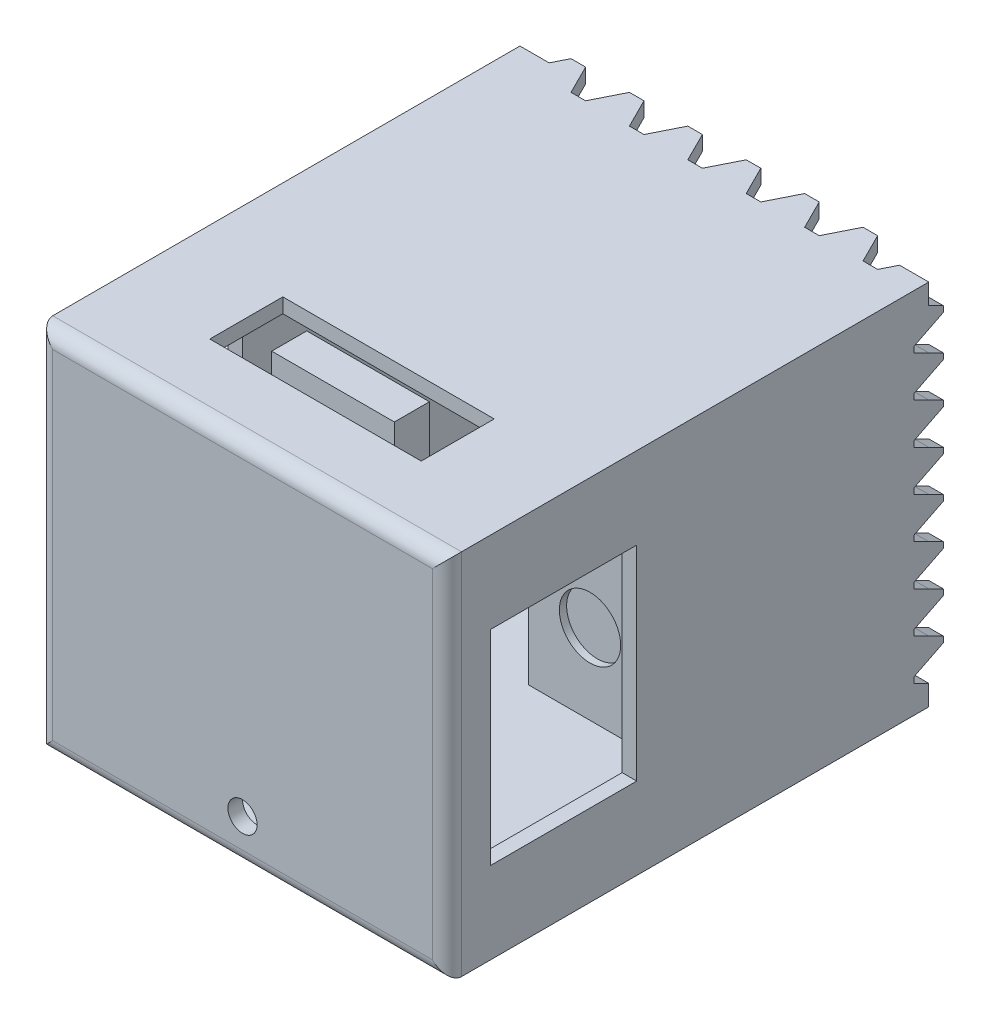
from build123d import *

# Parameters (mm, degrees)
SKETCH1_W                = 140
SKETCH1_H                = 126
BOSS_EXTRUDE1_DEPTH      = 170
FILLET_2_R               = 5
INTERIOR_START           = -5
INTERIOR_SKETCH_W        = 130
INTERIOR_SKETCH_H        = 116
INTERIOR_CUT_DEPTH       = 209.596698034
WINDOW_CUT_REACH         = 240.864
WINDOW_SKETCH_W          = 50
WINDOW_SKETCH_H          = 70
TEETH_START              = -5
TEETH_CUT_1_DEPTH        = 5
TEETH_CUT_2_DEPTH        = 5
TEETH_CUT_TOP_DEPTH      = 231.094734018
TEETH_CUT_TOP_DEPTH_BACK = 5
TEETH_CUT_BOT_DEPTH      = 5
DISPLAY_SKETCH_W         = 72.4
DISPLAY_SKETCH_H         = 25
DISPLAY_CUT_DEPTH        = 5
WIREHOLE_SKETCH_R        = 5
WIREHOLE_CUT_DEPTH       = 5
MOUNT_SKETCH_1_W         = 12
MOUNT_SKETCH_1_H         = 55
SERVO_MOUNT_1_DEPTH      = 42
MOUNT_SKETCH_2_W         = 12
MOUNT_SKETCH_2_H         = 55
SERVO_MOUNT_2_DEPTH      = 42
INDENT_SKETCH_1_R        = 10.5
SERVO_INDENT_1_DEPTH     = 2.5
INDENT_SKETCH_2_R        = 10.5
SERVO_INDENT_2_DEPTH     = 2.5


# Read off the part's stored shape, not the designer's step: Teeth Cut 1, Teeth Cut 2, Teeth Cut Bot
with BuildPart() as part:
    # Sketch1 → Boss-Extrude1 (new body)
    with BuildSketch(Plane.XY):
        with Locations((-20.374701232, -29.49844749)):
            Rectangle(SKETCH1_W, SKETCH1_H)
    extrude(amount=-BOSS_EXTRUDE1_DEPTH)

    # Fillet 2
    fillet_2_edges = [part.edges().sort_by_distance(p)[0] for p in [
        (-20.374701232, 33.50155251, 0),
        (49.625298768, -29.49844749, 0),
        (-20.374701232, -92.49844749, 0),
        (-90.374701232, -29.49844749, 0),
    ]]
    fillet(fillet_2_edges, radius=FILLET_2_R)

    # Interior Sketch → Interior Cut (cut, through all)
    with BuildSketch(Plane.XY.offset(INTERIOR_START)):
        with Locations((-20.374701232, -29.49844749)):
            Rectangle(INTERIOR_SKETCH_W, INTERIOR_SKETCH_H)
    extrude(amount=-INTERIOR_CUT_DEPTH, mode=Mode.SUBTRACT)

    # Window Cut: up to this face of the body (flat: up to its plane)
    window_cut_end = Plane(part.part.faces().sort_by_distance((-90.374701232, -29.49844749, -87.5))[0])
    # Window Sketch → Window Cut (cut, up to the picked face)
    with BuildSketch(Plane(origin=(49.625298768, 0, 0), x_dir=(0, 0, -1), z_dir=(1, 0, 0)), mode=Mode.PRIVATE) as window_cut_sk1:
        with Locations((40, -29.49844749)):
            Rectangle(WINDOW_SKETCH_W, WINDOW_SKETCH_H)
    window_cut_tool1 = split(extrude(window_cut_sk1.sketch, amount=-WINDOW_CUT_REACH, mode=Mode.PRIVATE), bisect_by=window_cut_end, keep=Keep.BOTH, mode=Mode.PRIVATE)
    add(window_cut_tool1.solids().sort_by(Axis((49.625299, -29.498447, -40), (-1, 0, 0)))[0], mode=Mode.SUBTRACT)

    # Teeth Cut 1 outline → Teeth Cut 1 (cut)
    with BuildSketch(Plane(origin=(49.625298768, 0, 0), x_dir=(0, 0, -1), z_dir=(1, 0, 0)).offset(TEETH_START)):
        Polygon((170, 22.00155251), (160, 17.00155251), (160, 15.00155251), (170, 10.00155251), align=None)
        Polygon((165, 26.50155251), (170, 24.00155251), (170, 33.50155251), (165, 33.50155251), align=None)
        Polygon((170, -92.49844749), (170, -75.99844749), (160, -80.99844749), (160, -82.99844749), (165, -85.49844749), (165, -92.49844749), align=None)
        Polygon((170, -73.99844749), (170, -61.99844749), (160, -66.99844749), (160, -68.99844749), align=None)
        Polygon((170, -59.99844749), (170, -47.99844749), (160, -52.99844749), (160, -54.99844749), align=None)
        Polygon((170, -45.99844749), (170, -33.99844749), (160, -38.99844749), (160, -40.99844749), align=None)
        Polygon((170, -31.99844749), (170, -19.99844749), (160, -24.99844749), (160, -26.99844749), align=None)
        Polygon((170, -17.99844749), (170, -5.99844749), (160, -10.99844749), (160, -12.99844749), align=None)
        Polygon((170, -3.99844749), (170, 8.00155251), (160, 3.00155251), (160, 1.00155251), align=None)
    extrude(amount=TEETH_CUT_1_DEPTH, mode=Mode.SUBTRACT)

    # Teeth Cut 2 outline → Teeth Cut 2 (cut)
    with BuildSketch(Plane.ZY.offset(90.374701232).offset(TEETH_START)):
        Polygon((-170, -80.99844749), (-160, -75.99844749), (-160, -73.99844749), (-170, -68.99844749), align=None)
        Polygon((-165, -85.49844749), (-170, -82.99844749), (-170, -92.49844749), (-165, -92.49844749), align=None)
        Polygon((-170, 33.50155251), (-170, 17.00155251), (-160, 22.00155251), (-160, 24.00155251), (-165, 26.50155251), (-165, 33.50155251), align=None)
        Polygon((-170, 15.00155251), (-170, 3.00155251), (-160, 8.00155251), (-160, 10.00155251), align=None)
        Polygon((-170, 1.00155251), (-170, -10.99844749), (-160, -5.99844749), (-160, -3.99844749), align=None)
        Polygon((-170, -12.99844749), (-170, -24.99844749), (-160, -19.99844749), (-160, -17.99844749), align=None)
        Polygon((-170, -26.99844749), (-170, -38.99844749), (-160, -33.99844749), (-160, -31.99844749), align=None)
        Polygon((-170, -40.99844749), (-170, -52.99844749), (-160, -47.99844749), (-160, -45.99844749), align=None)
        Polygon((-170, -54.99844749), (-170, -66.99844749), (-160, -61.99844749), (-160, -59.99844749), align=None)
    extrude(amount=TEETH_CUT_2_DEPTH, mode=Mode.SUBTRACT)

    # Teeth Sketch Top → Teeth Cut Top (cut, two sides: drawn at the far end of the back side and taken through both)
    with BuildSketch(Plane(origin=(0, 33.50155251, 0), x_dir=(1, 0, 0), z_dir=(0, 1, 0)).offset(-TEETH_CUT_TOP_DEPTH_BACK)):
        Polygon((39.625298768, 165), (44.625298768, 165), (44.625298768, 170), (27.125298768, 170), (32.125298768, 160), (37.125298768, 160), align=None)
        Polygon((17.125298768, 160), (22.125298768, 170), (7.125298768, 170), (12.125298768, 160), align=None)
        Polygon((-2.874701232, 160), (2.125298768, 170), (-12.874701232, 170), (-7.874701232, 160), align=None)
        Polygon((-85.374701232, 170), (-85.374701232, 165), (-80.374701232, 165), (-77.874701232, 170), align=None)
        Polygon((-22.874701232, 160), (-17.874701232, 170), (-32.874701232, 170), (-27.874701232, 160), align=None)
        Polygon((-57.874701232, 170), (-72.874701232, 170), (-67.874701232, 160), (-62.874701232, 160), align=None)
        Polygon((-42.874701232, 160), (-37.874701232, 170), (-52.874701232, 170), (-47.874701232, 160), align=None)
    extrude(amount=TEETH_CUT_TOP_DEPTH + TEETH_CUT_TOP_DEPTH_BACK, mode=Mode.SUBTRACT)

    # Teeth Cut Bot outline → Teeth Cut Bot (cut)
    with BuildSketch(Plane.XZ.offset(92.49844749).offset(TEETH_START)):
        Polygon((-67.874701232, -170), (-72.874701232, -160), (-77.874701232, -160), (-80.374701232, -165), (-85.374701232, -165), (-85.374701232, -170), align=None)
        Polygon((39.625298768, -165), (37.125298768, -170), (44.625298768, -170), (44.625298768, -165), align=None)
        Polygon((22.125298768, -160), (17.125298768, -170), (32.125298768, -170), (27.125298768, -160), align=None)
        Polygon((2.125298768, -160), (-2.874701232, -170), (12.125298768, -170), (7.125298768, -160), align=None)
        Polygon((-17.874701232, -160), (-22.874701232, -170), (-7.874701232, -170), (-12.874701232, -160), align=None)
        Polygon((-37.874701232, -160), (-42.874701232, -170), (-27.874701232, -170), (-32.874701232, -160), align=None)
        Polygon((-57.874701232, -160), (-62.874701232, -170), (-47.874701232, -170), (-52.874701232, -160), align=None)
    extrude(amount=TEETH_CUT_BOT_DEPTH, mode=Mode.SUBTRACT)

    # Display Sketch → Display Cut (cut)
    with BuildSketch(Plane(origin=(0, 33.50155251, 0), x_dir=(1, 0, 0), z_dir=(0, 1, 0))):
        with Locations((-20.374701232, 37.5)):
            Rectangle(DISPLAY_SKETCH_W, DISPLAY_SKETCH_H)
    extrude(amount=-DISPLAY_CUT_DEPTH, mode=Mode.SUBTRACT)

    # WireHole Sketch → WireHole Cut (cut)
    with BuildSketch(Plane.XY):
        with Locations((-20.374701232, -77.49844749)):
            Circle(WIREHOLE_SKETCH_R)
    extrude(amount=-WIREHOLE_CUT_DEPTH, mode=Mode.SUBTRACT)

    # Mount Sketch 1 → Servo Mount 1 (add)
    with BuildSketch(Plane.ZY.offset(-44.625298768)):
        with Locations((-81, -36.99844749)):
            Rectangle(MOUNT_SKETCH_1_W, MOUNT_SKETCH_1_H)
    extrude(amount=SERVO_MOUNT_1_DEPTH)

    # Mount Sketch 2 → Servo Mount 2 (add)
    with BuildSketch(Plane(origin=(-85.374701232, 0, 0), x_dir=(0, 0, -1), z_dir=(1, 0, 0))):
        with Locations((81, -36.99844749)):
            Rectangle(MOUNT_SKETCH_2_W, MOUNT_SKETCH_2_H)
    extrude(amount=SERVO_MOUNT_2_DEPTH)

    # Indent Sketch 1 → Servo Indent 1 (cut)
    with BuildSketch(Plane.XY.offset(-75)):
        with Locations((23.625298768, -36.99844749)):
            Circle(INDENT_SKETCH_1_R)
    extrude(amount=-SERVO_INDENT_1_DEPTH, mode=Mode.SUBTRACT)

    # Indent Sketch 2 → Servo Indent 2 (cut)
    with BuildSketch(Plane.XY.offset(-75)):
        with Locations((-64.374701232, -36.99844749)):
            Circle(INDENT_SKETCH_2_R)
    extrude(amount=-SERVO_INDENT_2_DEPTH, mode=Mode.SUBTRACT)


solid = part.part
